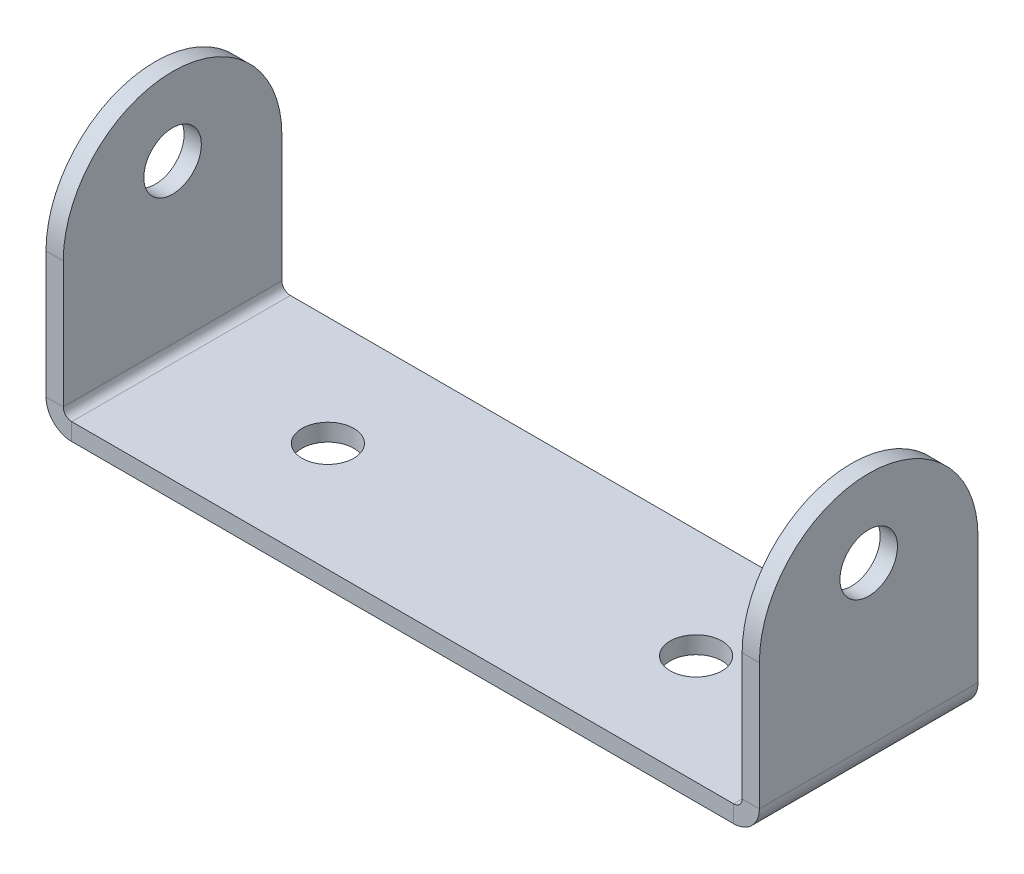
from build123d import *

# Parameters (mm, degrees)
SKETCH1_W                    = 62
SKETCH1_H                    = 19
SKETCH1_R                    = 2.25
BASE_FLANGE1_DEPTH           = 1.5
EDGE_FLANGE1_STRIP_W         = 7.4732
EDGE_FLANGE1_STRIP_H         = 1.5
EDGE_FLANGE1_STRIP_CUT_DEPTH = 19
EDGE_FLANGE1_DEPTH           = 19
EDGE_FLANGE2_STRIP_W         = 7.4732
EDGE_FLANGE2_STRIP_H         = 1.5
EDGE_FLANGE2_STRIP_CUT_DEPTH = 19
EDGE_FLANGE2_DEPTH           = 19
SKETCH12_R                   = 2.5
CUT_EXTRUDE1_DEPTH           = 69.317274536


# Sheet-metal steps are written as plain solids
with BuildPart() as part:
    # Sketch1 → Base-Flange1 (new body)
    with BuildSketch(Plane(origin=(0, 0, 0), x_dir=(1, 0, 0), z_dir=(0, 1, 0))):
        with Locations((31, 9.5)):
            Rectangle(SKETCH1_W, SKETCH1_H)
        with Locations(Location((15, 9.5, 0), (0, 0, 270))):
            Circle(SKETCH1_R, mode=Mode.SUBTRACT)
        with Locations(Location((47, 9.5, 0), (0, 0, 270))):
            Circle(SKETCH1_R, mode=Mode.SUBTRACT)
    extrude(amount=-BASE_FLANGE1_DEPTH)

    # Edge-Flange1 strip (across the edge) → Edge-Flange1 strip cut (cut)
    with BuildSketch(Plane.XY.offset(-19)):
        with Locations((-1.5, -0.75)):
            Rectangle(EDGE_FLANGE1_STRIP_W, EDGE_FLANGE1_STRIP_H)
    extrude(amount=EDGE_FLANGE1_STRIP_CUT_DEPTH, mode=Mode.SUBTRACT)

    # Edge-Flange1 section (across the edge) → Edge-Flange1 (add)
    with BuildSketch(Plane.XY.offset(-19)):
        with BuildLine():
            Line((0, 0.7366), (0, 21.5))
            Line((0, 21.5), (1.5, 21.5))
            Line((1.5, 21.5), (1.5, 0.7366))
            ThreePointArc((1.5, 0.7366), (1.715745145, 0.215745145), (2.2366, 0))
            Line((2.2366, 0), (2.2366, -1.5))
            ThreePointArc((2.2366, -1.5), (0.655084973, -0.844915027), (0, 0.7366))
        make_face()
    extrude(amount=EDGE_FLANGE1_DEPTH)

    # Edge-Flange2 strip (across the edge) → Edge-Flange2 strip cut (cut)
    with BuildSketch(Plane(origin=(62, 0, 0), x_dir=(-1, 0, 0), z_dir=(0, 0, -1))):
        with Locations((-1.5, -0.75)):
            Rectangle(EDGE_FLANGE2_STRIP_W, EDGE_FLANGE2_STRIP_H)
    extrude(amount=EDGE_FLANGE2_STRIP_CUT_DEPTH, mode=Mode.SUBTRACT)

    # Edge-Flange2 section (across the edge) → Edge-Flange2 (add)
    with BuildSketch(Plane(origin=(62, 0, 0), x_dir=(-1, 0, 0), z_dir=(0, 0, -1))):
        with BuildLine():
            Line((0, 0.7366), (0, 21.5))
            Line((0, 21.5), (1.5, 21.5))
            Line((1.5, 21.5), (1.5, 0.7366))
            ThreePointArc((1.5, 0.7366), (1.715745145, 0.215745145), (2.2366, 0))
            Line((2.2366, 0), (2.2366, -1.5))
            ThreePointArc((2.2366, -1.5), (0.655084973, -0.844915027), (0, 0.7366))
        make_face()
    extrude(amount=EDGE_FLANGE2_DEPTH)

    # Sketch12 → Cut-Extrude1 (cut, through all)
    with BuildSketch(Plane(origin=(62, 0, 0), x_dir=(0, 0, -1), z_dir=(1, 0, 0))):
        with Locations(Location((9.5, 14.5, 0), (0, 0, 90))):
            Circle(SKETCH12_R)
        with BuildLine():
            Line((0, 11.7366), (-3.023600292, 11.7366))
            Line((-3.023600292, 11.7366), (-3.023600292, 23.521513474))
            Line((-3.023600292, 23.521513474), (21.663618521, 23.521513474))
            Line((21.663618521, 23.521513474), (21.663618521, 11.7366))
            Line((21.663618521, 11.7366), (19, 11.7366))
            ThreePointArc((19, 11.7366), (9.5, 21.2366), (0, 11.7366))
        make_face()
    extrude(amount=-CUT_EXTRUDE1_DEPTH, mode=Mode.SUBTRACT)


solid = part.part
